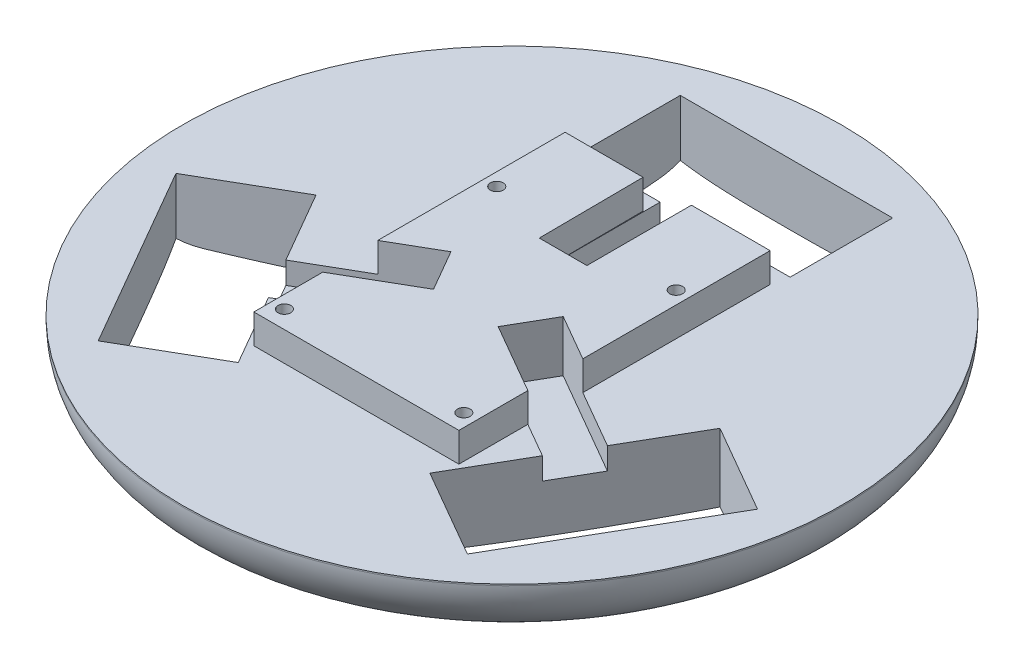
from build123d import *

# Parameters (mm, degrees)
SKETCH2_W           = 58
SKETCH2_H           = 28
CUT_EXTRUDE1_DEPTH  = 40
SKETCH4_W           = 13
SKETCH4_H           = 33
CUT_EXTRUDE2_DEPTH  = 6
SKETCH5_R           = 1.75
BOSS_EXTRUDE1_DEPTH = 8


with BuildPart() as part:
    # Sketch3 → Revolve1 (revolve)
    with BuildSketch(Plane(origin=(0, 0, 0), x_dir=(0, 0, -1), z_dir=(1, 0, 0))):
        with BuildLine():
            Line((90, 19.61346208), (90, 20))
            Line((90, 20), (0, 20))
            Line((0, 20), (0, 0))
            ThreePointArc((0, 0), (37.693021313, 0.371235712), (75.280837989, 3.209846135))
            ThreePointArc((75.280837989, 3.209846135), (85.78075378, 8.593793909), (90, 19.61346208))
        make_face()
    revolve(axis=Axis((0, 20, 0), (0, -1, 0)))

    # Sketch2 → Cut-Extrude1 (cut)
    with BuildSketch(Plane(origin=(0, 0, 0), x_dir=(1, 0, 0), z_dir=(0, 1, 0))):
        with Locations((0, 60.949465814)):
            Rectangle(SKETCH2_W, SKETCH2_H)
        Polygon((79.408141395, -12.359996197), (50.408141395, -62.589469617), (26.159430089, -48.589469617), (55.159430089, 1.640003803), align=None)
        Polygon((-50.408141395, -62.589469617), (-79.408141395, -12.359996197), (-55.159430089, 1.640003803), (-26.159430089, -48.589469617), align=None)
    extrude(amount=CUT_EXTRUDE1_DEPTH, mode=Mode.SUBTRACT)

    # Sketch4 → Cut-Extrude2 (cut)
    with BuildSketch(Plane(origin=(0, 20, 0), x_dir=(1, 0, 0), z_dir=(0, 1, 0))):
        with Locations((0, 30.449465814)):
            Rectangle(SKETCH4_W, SKETCH4_H)
        Polygon((37.409430089, -29.103898031), (43.909430089, -17.845567782), (15.330591764, -1.345567782), (8.830591764, -12.603898031), align=None)
        Polygon((-43.909430089, -17.845567782), (-37.409430089, -29.103898031), (-8.830591764, -12.603898031), (-15.330591764, -1.345567782), align=None)
    extrude(amount=-CUT_EXTRUDE2_DEPTH, mode=Mode.SUBTRACT)

    # Sketch5 → Boss-Extrude1 (add)
    with BuildSketch(Plane(origin=(0, 20, 0), x_dir=(1, 0, 0), z_dir=(0, 1, 0))):
        Polygon((-28, -23.671361037), (-8.830591764, -12.603898031), (-15.330591764, -1.345567782), (-28, -8.660254038), (-28, 42.5), (-6.711328351, 42.5), (-6.5, 13.949465814), (6.5, 13.949465814), (6.5, 42.5), (28, 42.5), (28, -8.660254038), (15.330591764, -1.345567782), (8.830591764, -12.603898031), (28, -23.671361037), (28, -42.5), (-28, -42.5), align=None)
        with Locations((-24.5, -37.660254038)):
            Circle(SKETCH5_R, mode=Mode.SUBTRACT)
        with Locations((24.5, -37.660254038)):
            Circle(SKETCH5_R, mode=Mode.SUBTRACT)
        with Locations((24.5, 20.339745962)):
            Circle(SKETCH5_R, mode=Mode.SUBTRACT)
        with Locations((-24.5, 20.339745962)):
            Circle(SKETCH5_R, mode=Mode.SUBTRACT)
    extrude(amount=BOSS_EXTRUDE1_DEPTH)


solid = part.part
